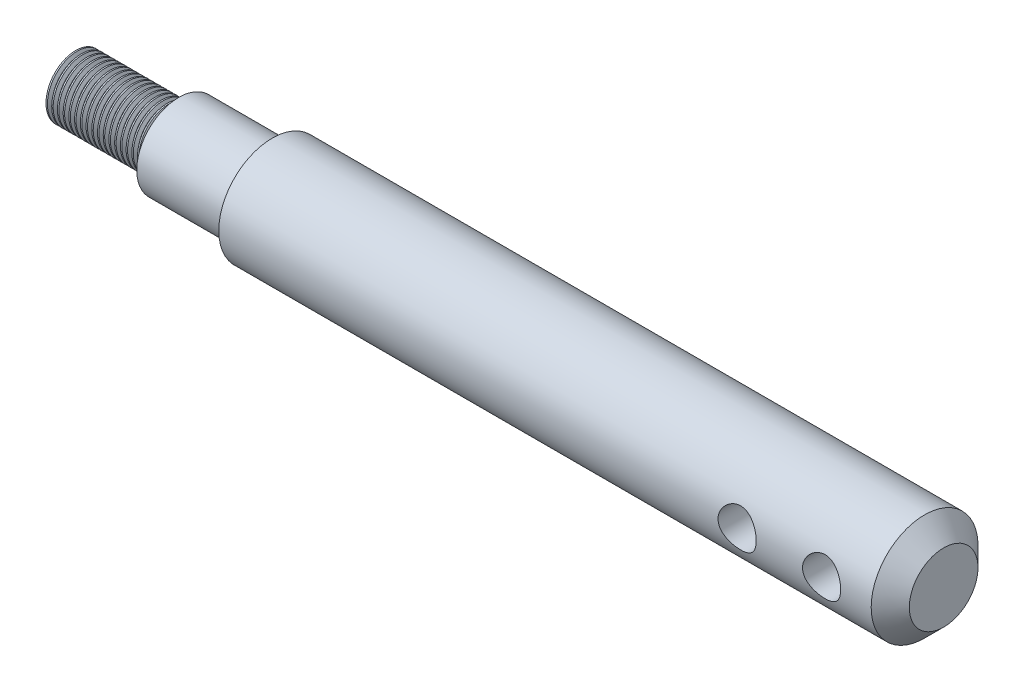
from build123d import *

# Parameters (mm, degrees)
F_10_0_10_DIAMETER_HOLE1_D = 10
THREAD1_PITCH              = 1.5


with BuildPart() as part:
    # Sketch2 → Revolve1 (revolve)
    with BuildSketch(Plane.XY, mode=Mode.PRIVATE) as revolve1_sk:
        Polygon((0, 0), (228, 0), (228, 9), (223, 14), (52, 14), (52, 11), (27.5, 11), (27.5, 7.13), (0, 7.13), align=None)
    revolve(revolve1_sk.sketch.rotate(Axis((0, 0, 0), (1, 0, 0)), 90), axis=Axis((0, 0, 0), (1, 0, 0)))

    # Ø10.0 (10) Diameter Hole1 (through all)
    with Locations(Plane.XY.offset(20)):
        with Locations((210, 0), (187.86, 0)):
            Hole(F_10_0_10_DIAMETER_HOLE1_D / 2)

    # Thread1: the profile of Thread Profile1 profile screwed along a right-hand helix of 19 turns, 8 arcs to a turn; built about Z, then put on its axis
    thread1_z = Axis((0, 0, 0), (0, 0, 1))
    thread1_corners = [(7.1297, 0, -0.000173205), (7.1297, 0, 1.312673201), (7.941898813, 0, 0.843749998), (7.941898813, 0, 0.468749998)]
    with BuildLine(mode=Mode.PRIVATE) as thread1_profile:
        Line(thread1_corners[0], thread1_corners[1])
        Line(thread1_corners[1], thread1_corners[2])
        Line(thread1_corners[2], thread1_corners[3])
        Line(thread1_corners[3], thread1_corners[0])
    thread1_cap = Face(thread1_profile.wire())
    thread1_turn_angles = [0, 22.5, 45, 67.5, 90, 112.5, 135, 157.5, 180, 202.5, 225, 247.5, 270, 292.5, 315, 337.5, 360]
    thread1_turn_weights = [1, 0.9238795325112867, 1, 0.9238795325112867, 1, 0.9238795325112867, 1, 0.9238795325112867, 1, 0.9238795325112867, 1, 0.9238795325112867, 1, 0.9238795325112867, 1, 0.9238795325112867, 1]
    thread1_turn_rails = [Edge.make_bspline([Vector(p[0], p[1], 0).rotate(thread1_z, thread1_turn_angles[k]) / thread1_turn_weights[k] + Vector(0, 0, p[2] + THREAD1_PITCH * thread1_turn_angles[k] / 360) for k in range(17)], [0, 0, 0, 1, 1, 2, 2, 3, 3, 4, 4, 5, 5, 6, 6, 7, 7, 8, 8, 8], 2, thread1_turn_weights) for p in thread1_corners]
    thread1_turn_sides = [Face.make_surface_from_curves(thread1_turn_rails[p[0]], thread1_turn_rails[p[1]]) for p in [(0, 1), (1, 2), (2, 3), (3, 0)]]
    thread1 = Plane(origin=(28.5, 0, 0), x_dir=(0, 0, 1), z_dir=(-1, 0, 0)) * Solid(Shell([*[p.moved(Location((0, 0, THREAD1_PITCH * i))) for i in range(19) for p in thread1_turn_sides], thread1_cap, thread1_cap.rotate(thread1_z, 6840).moved(Location((0, 0, THREAD1_PITCH * 6840 / 360)))]))
    add(thread1)

    # SurfaceCut1
    split(bisect_by=Plane(origin=(0, 0, 0), x_dir=(0, 0, -1), z_dir=(1, 0, 0)), keep=Keep.TOP)


solid = part.part
